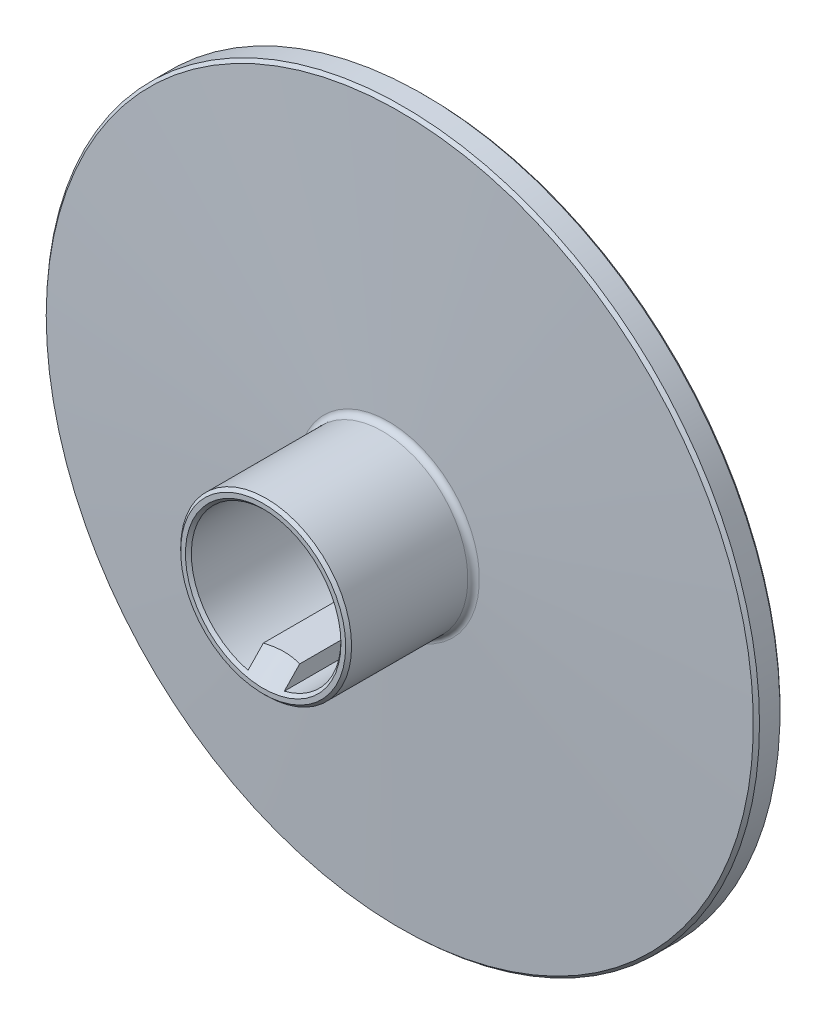
from build123d import *
from OCP.BRepFilletAPI import BRepFilletAPI_MakeChamfer

# Parameters (mm, degrees)
SKETCH1_R           = 22.25
BOSS_EXTRUDE1_DEPTH = 6
FILLET1_R           = 1
SKETCH3_R           = 12.695
CUT_EXTRUDE1_DEPTH  = 92.957544552
CHAMFER1_SIZE       = 0.5
CHAMFER1_SIZE2      = 0.523325215
BOSS_EXTRUDE2_DEPTH = 20
CHAMFER2_SIZE       = 3.5
FILLET2_R           = 1


with BuildPart() as part:
    # Sketch1 → Boss-Extrude1 (new body)
    with BuildSketch(Plane.XY):
        Circle(SKETCH1_R)
    extrude(amount=BOSS_EXTRUDE1_DEPTH)

    # Sketch2 → Revolve1 (revolve)
    with BuildSketch(Plane(origin=(0, 0, 0), x_dir=(1, 0, 0), z_dir=(0, 1, 0))):
        Polygon((-14.5, -12.508403374), (-14.5, -33.7), (0, -33.7), (0, -6), (-60.5, -6), (-60.5, -10.5), align=None)
    revolve(axis=Axis((0, 0, 33.7), (0, 0, 1)))

    # Fillet1
    fillet1_edges = [part.edges().sort_by_distance(p)[0] for p in [
        (-22.25, 0, 6),
    ]]
    fillet(fillet1_edges, radius=FILLET1_R)

    # Sketch3 → Cut-Extrude1 (cut, through all)
    with BuildSketch(Plane.XY.offset(33.7)):
        Circle(SKETCH3_R)
    extrude(amount=-CUT_EXTRUDE1_DEPTH, mode=Mode.SUBTRACT)

    # Chamfer1: one chamfer whose edges measure the first distance from different faces: ONE call of the kernel's chamfer builder (chamfer() names one face for all edges)
    chamfer1_edges_1 = [part.edges().sort_by_distance(p)[0] for p in [
        (-22.25, 0, 0),
        (60.5, 0, 6),
        (14.5, 0, 33.7),
    ]]
    chamfer1_edges_2 = [part.edges().sort_by_distance(p)[0] for p in [
        (60.5, 0, 10.5),
    ]]
    chamfer1_side_2 = [part.faces().sort_by_distance(p)[0] for p in [
        (37.5, 0, 11.504201687),
    ]]
    chamfer1 = BRepFilletAPI_MakeChamfer(part.part.solid().wrapped)
    for e in chamfer1_edges_1:
        chamfer1.Add(CHAMFER1_SIZE, e.wrapped)
    for e in chamfer1_edges_2:
        chamfer1.Add(CHAMFER1_SIZE, CHAMFER1_SIZE2, e.wrapped, chamfer1_side_2[0].wrapped)  # the first distance lies on this face
    add(Compound.cast(chamfer1.Shape()), mode=Mode.REPLACE)

    # Sketch4 → Boss-Extrude2 (add)
    with BuildSketch(Plane.XY.offset(33.7)):
        with BuildLine():
            Line((-3.075, -12.316955793), (-3.075, -9.61))
            Line((-3.075, -9.61), (3.075, -9.61))
            Line((3.075, -9.61), (3.075, -12.316955793))
            ThreePointArc((3.075, -12.316955793), (0, -12.695), (-3.075, -12.316955793))
        make_face()
    extrude(amount=-BOSS_EXTRUDE2_DEPTH)

    # Sketch5 → Cut-Revolve1 (revolve, cut)
    with BuildSketch(Plane(origin=(0, 0, 0), x_dir=(1, 0, 0), z_dir=(0, 1, 0)), mode=Mode.PRIVATE) as cut_revolve1_sk:
        Polygon((-12.695, -33.2), (-13.195, -33.7), (-12.695, -33.7), align=None)
        Polygon((-9.195, -33.7), (-12.695, -33.7), (-12.695, -33.2), (-9.195, -29.7), align=None)
    revolve(cut_revolve1_sk.sketch.rotate(Axis((0, 0, 0), (0, 0, -1)), 180), axis=Axis((0, 0, 0), (0, 0, -1)), mode=Mode.SUBTRACT)

    # Chamfer2
    # the kernel refuses this chamfer: 3.5 mm, written as the material it takes off along each edge
    with BuildSketch(Plane(origin=(-12.075890458, -9.61, 13.7), x_dir=(0, -0.9996219169112968, -0.027495876610586605), z_dir=(1, 0, 0))) as chamfer2_piece_1_section:
        Polygon((CHAMFER2_SIZE * 0.999621916911, -CHAMFER2_SIZE * 0.0274958766106), (-CHAMFER2_SIZE * 0.0274958766106, -CHAMFER2_SIZE * 0.999621916911), (0, 0), align=None)
    chamfer2_piece_1 = extrude(amount=24.151780916, mode=Mode.PRIVATE)
    chamfer2_piece_1 = chamfer2_piece_1 & Plane(origin=(0, 0, 14.984613596), x_dir=(1, 0, 0), z_dir=(0, 0, 1)) * Cylinder(12.695, 63, mode=Mode.PRIVATE)
    add(chamfer2_piece_1, mode=Mode.SUBTRACT)

    # Fillet2
    fillet2_edges = [part.edges().sort_by_distance(p)[0] for p in [
        (14.5, 0, 12.508403374),
    ]]
    fillet(fillet2_edges, radius=FILLET2_R)


solid = part.part
